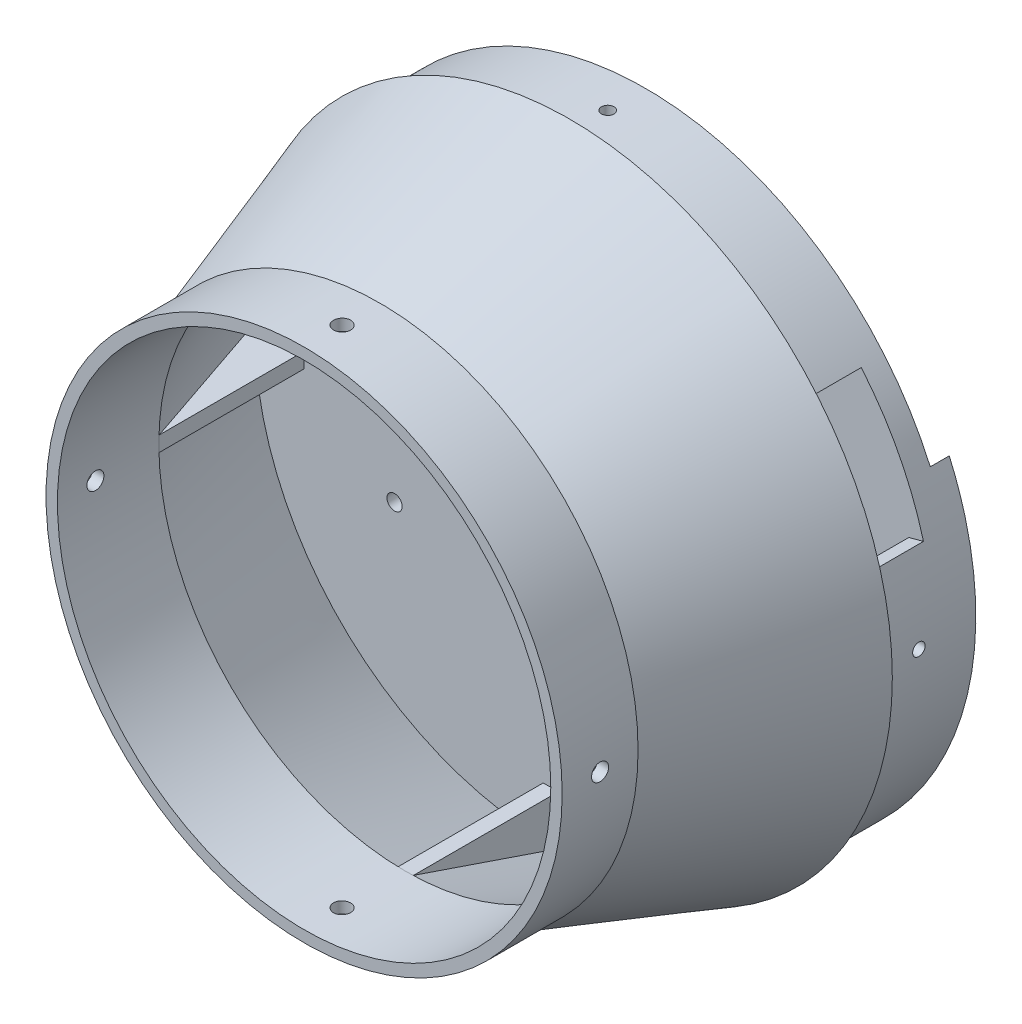
from build123d import *

# Parameters (mm, degrees)
RIB3_REACH                     = 141.104
SKETCH37_WALL_W                = 318.49944201
SKETCH37_WALL_H                = 4
CIRPATTERN3_COUNT              = 4
BOSS_EXTRUDE6_DEPTH            = 20
M4_CLEARANCE_HOLE2_D           = 4.5
M4_CLEARANCE_HOLE2_ON_FACE_2_D = 4.5
M4_CLEARANCE_HOLE2_ON_FACE_3_D = 4.5
M4_CLEARANCE_HOLE2_ON_FACE_4_D = 4.5
M4_CLEARANCE_HOLE1_D           = 4
CUT_EXTRUDE7_DEPTH             = 14
RIB4_START                     = -2
RIB4_OUTLINE_W                 = 10
RIB4_OUTLINE_H                 = 14
RIB4_DEPTH                     = 4
CIRPATTERN6_COUNT              = 4
BOSS_EXTRUDE10_START           = 5
BOSS_EXTRUDE10_DEPTH           = 5
CUT_EXTRUDE11_REACH            = 141.104
BOSS_EXTRUDE11_DEPTH           = 12
M3_TAPPED_HOLE1_REACH          = 190.212
M3_TAPPED_HOLE1_BORE_R         = 1.25
M4_TAPPED_HOLE1_D              = 3.3
M4_TAPPED_HOLE1_ON_FACE_2_D    = 3.3
M4_TAPPED_HOLE1_ON_FACE_3_D    = 3.3
M4_TAPPED_HOLE1_ON_FACE_4_D    = 3.3


# Read off the part's stored shape, not the designer's step: Rib4
with BuildPart() as part:
    # Sketch10 → Revolve2 (revolve)
    with BuildSketch(Plane(origin=(0, 0, 0), x_dir=(1, 0, 0), z_dir=(0, 1, 0))):
        Polygon((68, 0), (85, 50), (82, 50), (82, 70), (60, 70), (60, 64), (78, 64), (78, 50), (25, 50), (25, 45), (78.018901629, 45), (65, 6.709112855), (65, -20), (68, -20), align=None)
    revolve(axis=Axis((0, 0, 0), (0, 0, -1)))

    # Sketch37 wall → Rib3 (add, up to next)
    with BuildSketch(Plane(origin=(-65, 0, -25.854556428), x_dir=(0, 0, -1), z_dir=(-1, 0, 0)), mode=Mode.PRIVATE) as rib3_sk1:
        Rectangle(SKETCH37_WALL_W, SKETCH37_WALL_H)
    rib3_tool1 = extrude(rib3_sk1.sketch, amount=RIB3_REACH, mode=Mode.PRIVATE) - part.part
    rib3 = rib3_tool1.solids().sort_by_distance((-65, 0, -25.854556428))[0]
    add(rib3)

    # CirPattern3: Rib3 ×4 about axis
    cirpattern3_axis = Axis((0, 0, 0), (0, 0, 1))
    for i in range(1, CIRPATTERN3_COUNT):
        add(rib3.rotate(cirpattern3_axis, i * 360 / CIRPATTERN3_COUNT))

    # Sketch13 → Boss-Extrude6 (add)
    with BuildSketch(Plane(origin=(0, 0, -50), x_dir=(-1, 0, 0), z_dir=(0, 0, -1))):
        with BuildLine():
            ThreePointArc((82, 0), (78.943017424, 22.181073013), (70, 42.708313008))
            ThreePointArc((70, 42.708313008), (-82, 0), (70, -42.708313008))
            ThreePointArc((70, -42.708313008), (78.943017424, -22.181073013), (82, 0))
        make_face()
        with BuildLine():
            ThreePointArc((70, -34.409301068), (-78, 0), (70, 34.409301068))
            ThreePointArc((70, 34.409301068), (75.973679653, 17.663521733), (78, 0))
            ThreePointArc((78, 0), (75.973679653, -17.663521733), (70, -34.409301068))
        make_face(mode=Mode.SUBTRACT)
    extrude(amount=BOSS_EXTRUDE6_DEPTH)

    # M4 Clearance Hole2 (through all)
    with Locations(Plane(origin=(0, -68, 10), x_dir=(-1, 0, 0), z_dir=(0, -1, 0))):
        with Locations((0, 0)):
            Hole(M4_CLEARANCE_HOLE2_D / 2)

    # M4 Clearance Hole2 on face 2 (through all)
    with Locations(Plane(origin=(-68, 0, 10), x_dir=(0, 0, -1), z_dir=(-1, 0, 0))):
        with Locations((0, 0)):
            Hole(M4_CLEARANCE_HOLE2_ON_FACE_2_D / 2)

    # M4 Clearance Hole2 on face 3 (through all)
    with Locations(Plane(origin=(0, 68, 10), x_dir=(0, 0, 1), z_dir=(0, 1, 0))):
        with Locations((0, 0)):
            Hole(M4_CLEARANCE_HOLE2_ON_FACE_3_D / 2)

    # M4 Clearance Hole2 on face 4 (through all)
    with Locations(Plane(origin=(68, 0, 10), x_dir=(0, 0, 1), z_dir=(1, 0, 0))):
        with Locations((0, 0)):
            Hole(M4_CLEARANCE_HOLE2_ON_FACE_4_D / 2)

    # M4 Clearance Hole1 (through all)
    with Locations(Plane(origin=(0, 0, -50), x_dir=(-1, 0, 0), z_dir=(0, 0, -1))):
        with Locations((-42.868257487, 24.75), (-42.868257487, -24.75), (41.1648925, 23.305662216), (41.1648925, -20.519115646)):
            Hole(M4_CLEARANCE_HOLE1_D / 2)

    # Sketch19 → Cut-Extrude7 (cut)
    with BuildSketch(Plane(origin=(0, 0, -50), x_dir=(-1, 0, 0), z_dir=(0, 0, -1))):
        with BuildLine():
            Line((-75.342214451, 20.187885518), (-79.205917756, 21.223161698))
            ThreePointArc((-79.205917756, 21.223161698), (-72.734888321, 37.863386285), (-62.815644336, 52.708583994))
            Line((-62.815644336, 52.708583994), (-59.751466563, 50.137433556))
            ThreePointArc((-59.751466563, 50.137433556), (-69.186844988, 36.016391832), (-75.342214451, 20.187885518))
        make_face()
        with BuildLine():
            Line((59.751466563, 50.137433556), (62.815644336, 52.708583994))
            ThreePointArc((62.815644336, 52.708583994), (72.734888321, 37.863386285), (79.205917756, 21.223161698))
            Line((79.205917756, 21.223161698), (75.342214451, 20.187885518))
            ThreePointArc((75.342214451, 20.187885518), (69.186844988, 36.016391832), (59.751466563, 50.137433556))
        make_face()
    extrude(amount=CUT_EXTRUDE7_DEPTH, mode=Mode.SUBTRACT)

    # Rib4 outline → Rib4 (add)
    with BuildSketch(Plane(origin=(0, 0, 0), x_dir=(0.7071067811865477, 0.7071067811865475, 0), z_dir=(-0.7071067811865475, 0.7071067811865477, 0)).offset(RIB4_START)):
        with Locations((-73, 57)):
            Rectangle(RIB4_OUTLINE_W, RIB4_OUTLINE_H)
    rib4 = extrude(amount=RIB4_DEPTH)

    # CirPattern6: Rib4 ×4 about axis
    cirpattern6_axis = Axis((0, 0, 0), (0, 0, 1))
    for i in range(1, CIRPATTERN6_COUNT):
        add(rib4.rotate(cirpattern6_axis, i * 360 / CIRPATTERN6_COUNT))

    # Sketch29 → Boss-Extrude10 (add)
    with BuildSketch(Plane(origin=(0, 0, -70), x_dir=(-1, 0, 0), z_dir=(0, 0, -1)).offset(BOSS_EXTRUDE10_START)):
        with BuildLine():
            Line((-75, 0), (-75, 33.151168909))
            ThreePointArc((-75, 33.151168909), (0, -82), (75, 33.151168909))
            Line((75, 33.151168909), (75, 0))
            ThreePointArc((75, 0), (0, -75), (-75, 0))
        make_face()
    extrude(amount=-BOSS_EXTRUDE10_DEPTH)

    # Sketch30 → Cut-Extrude11 (cut, up to next)
    with BuildSketch(Plane(origin=(0, 0, -50), x_dir=(-1, 0, 0), z_dir=(0, 0, -1)), mode=Mode.PRIVATE) as cut_extrude11_sk1:
        with BuildLine():
            Line((-53.623111018, 44.995132678), (-58.98542212, 49.494645946))
            ThreePointArc((-58.98542212, 49.494645946), (-70.478983892, 31.011495119), (-76.341254326, 10.050516801))
            Line((-76.341254326, 10.050516801), (-69.401140296, 9.136833455))
            ThreePointArc((-69.401140296, 9.136833455), (-64.071803538, 28.19226829), (-53.623111018, 44.995132678))
        make_face()
    cut_extrude11_tool1 = extrude(cut_extrude11_sk1.sketch, amount=-CUT_EXTRUDE11_REACH, mode=Mode.PRIVATE) & part.part
    # Sketch30 → Cut-Extrude11 (cut, up to next)
    with BuildSketch(Plane(origin=(0, 0, -50), x_dir=(-1, 0, 0), z_dir=(0, 0, -1)), mode=Mode.PRIVATE) as cut_extrude11_sk2:
        with BuildLine():
            Line((53.623111018, 44.995132678), (58.98542212, 49.494645946))
            ThreePointArc((58.98542212, 49.494645946), (70.478983892, 31.011495119), (76.341254326, 10.050516801))
            Line((76.341254326, 10.050516801), (69.401140296, 9.136833455))
            ThreePointArc((69.401140296, 9.136833455), (64.071803538, 28.19226829), (53.623111018, 44.995132678))
        make_face()
    cut_extrude11_tool2 = extrude(cut_extrude11_sk2.sketch, amount=-CUT_EXTRUDE11_REACH, mode=Mode.PRIVATE) & part.part
    add(cut_extrude11_tool1.solids().sort_by_distance((66.427269, 29.228698, -50))[0], mode=Mode.SUBTRACT)
    add(cut_extrude11_tool2.solids().sort_by_distance((-66.427269, 29.228698, -50))[0], mode=Mode.SUBTRACT)

    # Sketch31 → Boss-Extrude11 (add)
    with BuildSketch(Plane(origin=(0, 0, -50), x_dir=(-1, 0, 0), z_dir=(0, 0, -1))):
        Polygon((-39.129305353, 8.825953921), (-38.252190239, 11.694868189), (-49.72784731, 15.203328646), (-47.681245377, 21.897461937), (-52.462769157, 23.359320461), (-55.386486204, 13.796272901), align=None)
        Polygon((-41.970161197, -14.147281334), (-62.052561072, -8.007475535), (-64.976278119, -17.570523094), (-60.194754339, -19.032381618), (-58.148152406, -12.338248326), (-42.847276311, -17.016195602), align=None)
    boss_extrude11 = extrude(amount=BOSS_EXTRUDE11_DEPTH)

    # M3 Tapped Hole1 bore → M3 Tapped Hole1 (cut, up to next)
    with BuildSketch(Plane(origin=(54.50937109, 16.665187169, 0), x_dir=(0, 0, -1), z_dir=(0.9563047559630348, 0.29237170472273905, 0)), mode=Mode.PRIVATE) as m3_tapped_hole1_sk1:
        with Locations((56.2, -0.65)):
            Circle(M3_TAPPED_HOLE1_BORE_R)
    m3_tapped_hole1_tool1 = extrude(m3_tapped_hole1_sk1.sketch, amount=-M3_TAPPED_HOLE1_REACH, mode=Mode.PRIVATE) & part.part
    # M3 Tapped Hole1 bore → M3 Tapped Hole1 (cut, up to next)
    with BuildSketch(Plane(origin=(54.50937109, 16.665187169, 0), x_dir=(0, 0, -1), z_dir=(0.9563047559630348, 0.29237170472273905, 0)), mode=Mode.PRIVATE) as m3_tapped_hole1_sk2:
        with Locations((56.2, -28.15)):
            Circle(M3_TAPPED_HOLE1_BORE_R)
    m3_tapped_hole1_tool2 = extrude(m3_tapped_hole1_sk2.sketch, amount=-M3_TAPPED_HOLE1_REACH, mode=Mode.PRIVATE) & part.part
    m3_tapped_hole1_1 = m3_tapped_hole1_tool1.solids().sort_by_distance((54.699413, 16.043589, -56.2))[0]
    add(m3_tapped_hole1_1, mode=Mode.SUBTRACT)
    m3_tapped_hole1_2 = m3_tapped_hole1_tool2.solids().sort_by_distance((62.739635, -10.254792, -56.2))[0]
    add(m3_tapped_hole1_2, mode=Mode.SUBTRACT)
    m3_tapped_hole1 = m3_tapped_hole1_1 + m3_tapped_hole1_2  # M3 Tapped Hole1 as one shape, for the pattern or mirror that repeats it

    # Mirror2: Boss-Extrude11, M3 Tapped Hole1 across plane
    add(boss_extrude11.mirror(Plane(origin=(0, 0, 0), x_dir=(0, 0, 1), z_dir=(1, 0, 0))))
    add(m3_tapped_hole1.mirror(Plane(origin=(0, 0, 0), x_dir=(0, 0, 1), z_dir=(1, 0, 0))), mode=Mode.SUBTRACT)

    # M4 Tapped Hole1 (through all)
    with Locations(Plane(origin=(-82, 0, -60), x_dir=(0, -1, 0), z_dir=(-1, 0, 0))):
        with Locations((0, 0)):
            Hole(M4_TAPPED_HOLE1_D / 2)

    # M4 Tapped Hole1 on face 2 (through all)
    with Locations(Plane(origin=(0, 82, -60), x_dir=(0, 0, 1), z_dir=(0, 1, 0))):
        with Locations((0, 0)):
            Hole(M4_TAPPED_HOLE1_ON_FACE_2_D / 2)

    # M4 Tapped Hole1 on face 3 (through all)
    with Locations(Plane(origin=(82, 0, -60), x_dir=(0, 0, 1), z_dir=(1, 0, 0))):
        with Locations((0, 0)):
            Hole(M4_TAPPED_HOLE1_ON_FACE_3_D / 2)

    # M4 Tapped Hole1 on face 4 (through all)
    with Locations(Plane(origin=(0, -82, -60), x_dir=(0, 0, -1), z_dir=(0, -1, 0))):
        with Locations((0, 0)):
            Hole(M4_TAPPED_HOLE1_ON_FACE_4_D / 2)


solid = part.part
